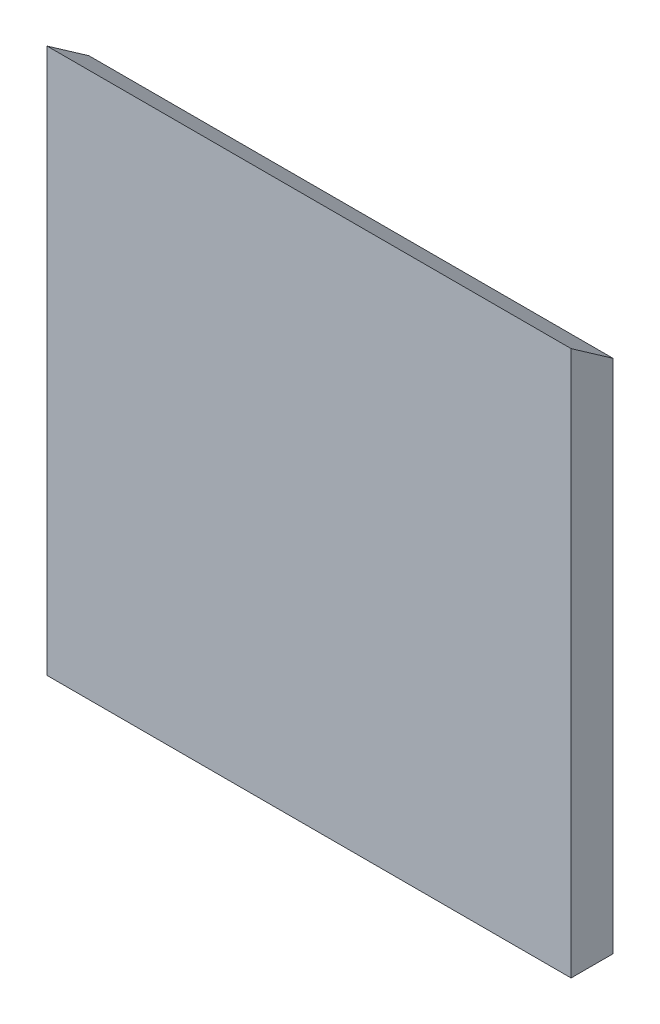
from build123d import *

# Parameters (mm, degrees)
ESQUISSE1_W        = 125
ESQUISSE1_H        = 130
BOSS_EXTRU_1_DEPTH = 10
CHANFREIN1_SIZE2   = 7.002075382
CHANFREIN1_SIZE    = 10


with BuildPart() as part:
    # Esquisse1 → Boss.-Extru.1 (new body)
    with BuildSketch(Plane.XY):
        with Locations((62.5, 65)):
            Rectangle(ESQUISSE1_W, ESQUISSE1_H)
    extrude(amount=BOSS_EXTRU_1_DEPTH)

    # Chanfrein1
    chanfrein1_edges = [part.edges().sort_by_distance(p)[0] for p in [
        (62.5, 130, 0),
    ]]
    chanfrein1_side = [part.faces().sort_by_distance(p)[0] for p in [
        (62.5, 130, 0.140041508),
    ]]
    chamfer(chanfrein1_edges, length=CHANFREIN1_SIZE - 0.0001, length2=CHANFREIN1_SIZE2 - 0.0001, reference=chanfrein1_side[0])  # a hair under: the kernel refuses the full size


solid = part.part
